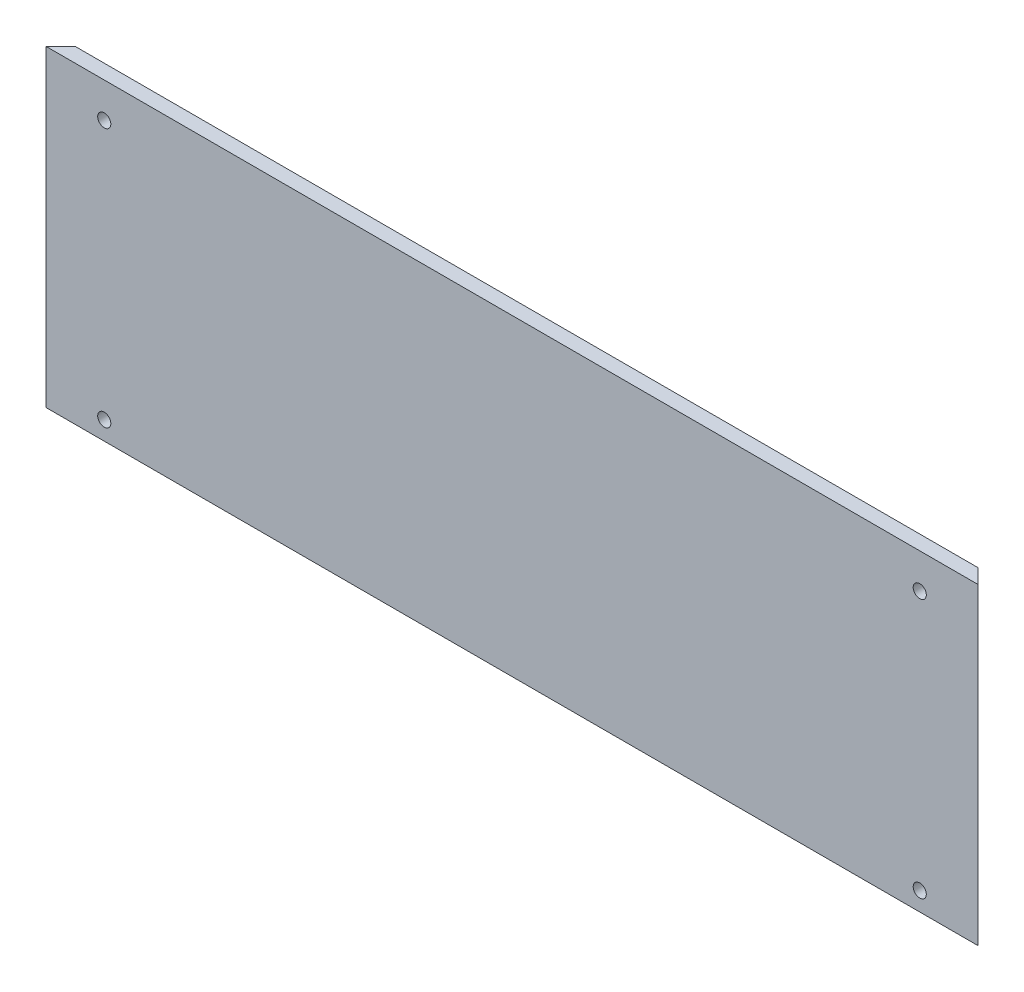
from build123d import *

# Parameters (mm, degrees)
SKETCH1_W           = 320
SKETCH1_H           = 110
SKETCH1_R           = 2.25
BOSS_EXTRUDE1_DEPTH = 5
SKETCH2_W           = 320
SKETCH2_H           = 105
SKETCH2_R           = 2.25
BOSS_EXTRUDE2_DEPTH = 3
CHAMFER1_SIZE       = 8
CHAMFER3_SIZE       = 3
SKETCH3_W           = 7.071067812
SKETCH3_H           = 2.6
CUT_EXTRUDE1_DEPTH  = 357.223151056


with BuildPart() as part:
    # Sketch1 → Boss-Extrude1 (new body)
    with BuildSketch(Plane.XY):
        with Locations((160, 55)):
            Rectangle(SKETCH1_W, SKETCH1_H)
        with Locations((20, 9)):
            Circle(SKETCH1_R, mode=Mode.SUBTRACT)
        with Locations(Location((300, 9, 0), (0, 0, 180))):
            Circle(SKETCH1_R, mode=Mode.SUBTRACT)
        with Locations((20, 98)):
            Circle(SKETCH1_R, mode=Mode.SUBTRACT)
        with Locations(Location((300, 98, 0), (0, 0, 180))):
            Circle(SKETCH1_R, mode=Mode.SUBTRACT)
    extrude(amount=-BOSS_EXTRUDE1_DEPTH)

    # Sketch2 → Boss-Extrude2 (add)
    with BuildSketch(Plane(origin=(0, 0, -5), x_dir=(-1, 0, 0), z_dir=(0, 0, -1))):
        with Locations((-160, 57.5)):
            Rectangle(SKETCH2_W, SKETCH2_H)
        with Locations(Location((-20, 9, 0), (0, 0, 180))):
            Circle(SKETCH2_R, mode=Mode.SUBTRACT)
        with Locations((-300, 9)):
            Circle(SKETCH2_R, mode=Mode.SUBTRACT)
        with Locations(Location((-20, 98, 0), (0, 0, 180))):
            Circle(SKETCH2_R, mode=Mode.SUBTRACT)
        with Locations((-300, 98)):
            Circle(SKETCH2_R, mode=Mode.SUBTRACT)
    extrude(amount=BOSS_EXTRUDE2_DEPTH)

    # Chamfer1
    # the kernel refuses this chamfer: 8 mm, written as the material it takes off along each edge
    with BuildSketch(Plane(origin=(320, -15.573463904, -8), x_dir=(-0.9996219169112968, 0, -0.0274958766105862), z_dir=(0, 1, 0)), Plane(origin=(0, 130.573463904, -8), x_dir=(0.9996219169112968, 0, -0.027495876610586275), z_dir=(0, -1, 0))) as chamfer1_piece_1:
        Polygon((CHAMFER1_SIZE * 0.999621916911, CHAMFER1_SIZE * 0.0274958766106), (-CHAMFER1_SIZE * 0.0274958766106, CHAMFER1_SIZE * 0.999621916911), (0, 0), align=None)
    extrude(amount=146.146927807, mode=Mode.SUBTRACT)

    # Chamfer3
    chamfer3_edges = [part.edges().sort_by_distance(p)[0] for p in [
        (160, 110, -8),
    ]]
    chamfer(chamfer3_edges, length=CHAMFER3_SIZE)

    # Sketch3 → Cut-Extrude1 (cut, through all, along a direction that is not the sketch's normal)
    with BuildSketch(Plane(origin=(160, 0, -160), x_dir=(-0.7071067811865452, 0, -0.7071067811865498), z_dir=(0.7071067811865498, 0, -0.7071067811865452))):
        with Locations((-222.738636074, 1.3)):
            Rectangle(SKETCH3_W, SKETCH3_H)
    extrude(amount=-CUT_EXTRUDE1_DEPTH, dir=(1, 0, 0), mode=Mode.SUBTRACT)


solid = part.part
